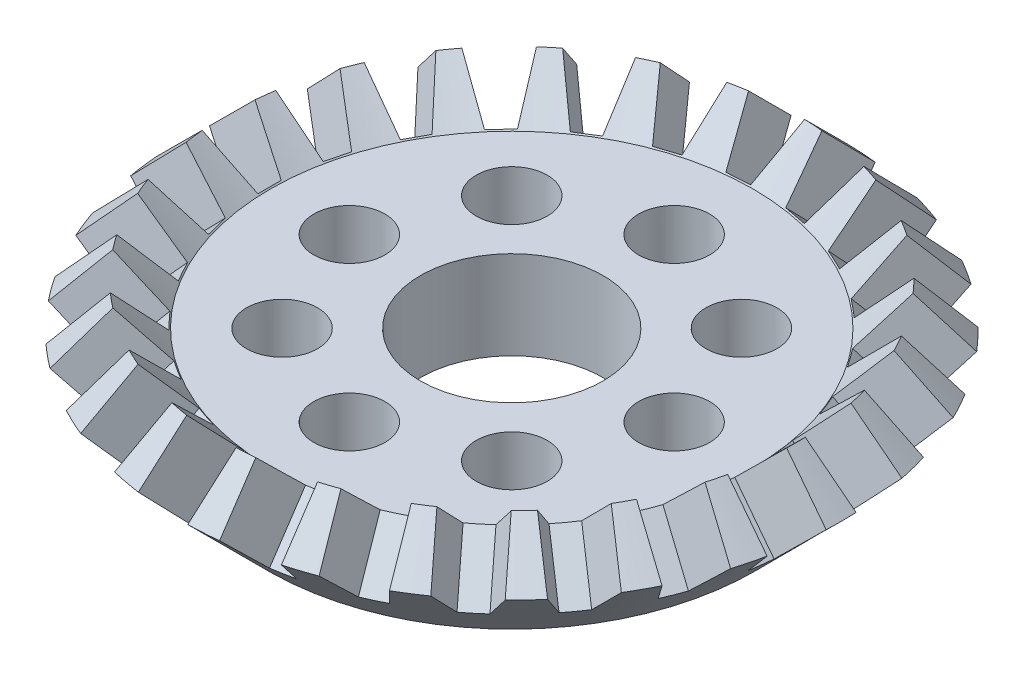
from build123d import *

# Parameters (mm, degrees)
CUT_EXTRUDE11_DEPTH = 10
CUT_EXTRUDE12_DEPTH = 10
SKETCH5_3_R         = 1.75
CUT_EXTRUDE13_DEPTH = 10
CIRPATTERN13_COUNT  = 8
CIRPATTERN14_COUNT  = 25


with BuildPart() as part:
    # Sketch2 → Revolve4 (revolve)
    with BuildSketch(Plane.XY):
        Polygon((0, 0), (0, 4.355813863), (-11.886826824, 4.355813863), (-14.008147168, 6.477134207), (-16.242640687, 4.242640687), (-12, 0), align=None)
    revolve(axis=Axis((0, 0, 0), (0, 1, 0)))

    # Sketch4 → Cut-Extrude11 (cut)
    with BuildSketch(Plane(origin=(-6, -6, 0), x_dir=(0, 0, 1), z_dir=(-0.7071067811865476, -0.7071067811865475, 0))):
        Polygon((-0.575906499, 11.556444953), (0.575906499, 11.556444953), (1.411909827, 14.888208465), (-1.411909827, 14.888208465), align=None)
    cut_extrude11 = extrude(amount=-CUT_EXTRUDE11_DEPTH, mode=Mode.SUBTRACT)

    # Sketch5 → Cut-Extrude12 (cut)
    with BuildSketch(Plane(origin=(0, 4.355813863, 0), x_dir=(1, 0, 0), z_dir=(0, 1, 0))):
        with BuildLine():
            ThreePointArc((4.5, 0), (-3.181980515, 3.181980515), (0, -4.5))
            ThreePointArc((0, -4.5), (3.181980515, -3.181980515), (4.5, 0))
        make_face()
    extrude(amount=-CUT_EXTRUDE12_DEPTH, mode=Mode.SUBTRACT)

    # Sketch5<3> → Cut-Extrude13 (cut)
    with BuildSketch(Plane(origin=(0, 4.355813863, 0), x_dir=(1, 0, 0), z_dir=(0, 1, 0))):
        with Locations((0, -8)):
            Circle(SKETCH5_3_R)
    cut_extrude13 = extrude(amount=-CUT_EXTRUDE13_DEPTH, mode=Mode.SUBTRACT)

    # CirPattern13: Cut-Extrude13 ×8 about axis
    cirpattern13_axis = Axis((0, 20.485281374, 0), (0, -1, 0))
    for i in range(1, CIRPATTERN13_COUNT):
        add(cut_extrude13.rotate(cirpattern13_axis, i * 360 / CIRPATTERN13_COUNT), mode=Mode.SUBTRACT)

    # CirPattern14: Cut-Extrude11 ×25 about axis
    cirpattern14_axis = Axis((0, 0, 0), (0, 1, 0))
    for i in range(1, CIRPATTERN14_COUNT):
        add(cut_extrude11.rotate(cirpattern14_axis, i * 360 / CIRPATTERN14_COUNT), mode=Mode.SUBTRACT)


solid = part.part
